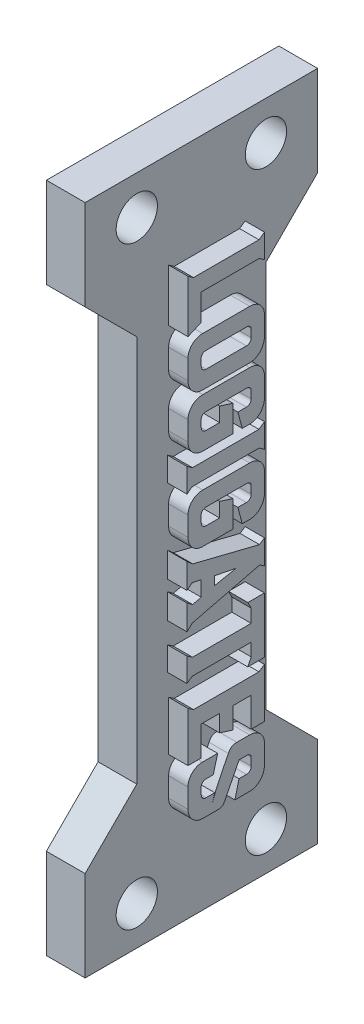
from build123d import *

# Parameters (mm, degrees)
SKETCH1_W           = 52.000002935
SKETCH1_H           = 18.000001088
SKETCH1_R           = 1.599502817
BOSS_EXTRUDE1_DEPTH = 2.999998629
SKETCH2_W           = 4
SKETCH2_H           = 30
CUT_EXTRUDE1_DEPTH  = 84.68851942
BOSS_EXTRUDE2_DEPTH = 1.5


# Read off the part's stored shape, not the designer's step: Boss-Extrude2
with BuildPart() as part:
    # Sketch1 → Boss-Extrude1 (new body)
    with BuildSketch(Plane(origin=(120.988696814, 0, 0), x_dir=(0, -1, 0), z_dir=(-1, 0, 0))):
        with Locations((49.005120062, 27.999999933)):
            Rectangle(SKETCH1_W, SKETCH1_H)
        with Locations(Location((26.005118371, 32.999999236, 0), (0, 0, 90))):
            Circle(SKETCH1_R, mode=Mode.SUBTRACT)
        with Locations(Location((26.005118371, 23.000000115, 0), (0, 0, 90))):
            Circle(SKETCH1_R, mode=Mode.SUBTRACT)
        with Locations(Location((72.005118202, 32.999999236, 0), (0, 0, 90))):
            Circle(SKETCH1_R, mode=Mode.SUBTRACT)
        with Locations(Location((72.005118202, 23.000000115, 0), (0, 0, 90))):
            Circle(SKETCH1_R, mode=Mode.SUBTRACT)
    extrude(amount=-BOSS_EXTRUDE1_DEPTH)

    # Sketch2 → Cut-Extrude1 (cut, through all)
    with BuildSketch(Plane.ZY.offset(-120.988696814)):
        with Locations((35.000000477, -49.005120061)):
            Rectangle(SKETCH2_W, SKETCH2_H)
        Polygon((33.000000477, -34.005120061), (37.000000477, -34.005120061), (37.000000477, -30.005120061), align=None)
        Polygon((22.999999389, -34.005120061), (18.999999389, -30.005120061), (18.999999389, -34.005120061), align=None)
        with Locations((20.999999389, -49.005120061)):
            Rectangle(SKETCH2_W, SKETCH2_H)
        Polygon((22.999999389, -64.005120061), (18.999999389, -64.005120061), (18.999999389, -68.005120061), align=None)
        Polygon((37.000000477, -68.005120061), (37.000000477, -64.005120061), (33.000000477, -64.005120061), align=None)
    extrude(amount=-CUT_EXTRUDE1_DEPTH, mode=Mode.SUBTRACT)

    # Boss-Extrude2 outline → Boss-Extrude2 (add)
    # profile 1 of 9: a face of its own
    with BuildSketch(Plane(origin=(123.988695443, 0, 0), x_dir=(0, 0, -1), z_dir=(1, 0, 0))):
        with BuildLine():
            add(Edge.make_bspline(
                [(-25.753945133, -34.83406743), (-25.715646692, -34.834896821), (-25.639935186, -34.836536429), (-25.52792408, -34.853255531), (-25.419341153, -34.880353785), (-25.314353768, -34.917863147), (-25.213548377, -34.962661631), (-25.119050654, -35.017514815), (-25.031442741, -35.080760556), (-24.949756401, -35.15098251), (-24.87544198, -35.228788716), (-24.809613425, -35.314359758), (-24.753268897, -35.40752816), (-24.703586132, -35.505728989), (-24.664134007, -35.609427085), (-24.635438933, -35.716823207), (-24.619535321, -35.827427877), (-24.616768551, -35.901866236), (-24.615376054, -35.939330588)],
                knots=[0, 0, 0, 0, 0.065110472, 0.128715735, 0.192163116, 0.255212122, 0.318136847, 0.37956254, 0.440708825, 0.501706905, 0.56256044, 0.623417995, 0.684959072, 0.747521206, 0.810395372, 0.873339532, 0.936252593, 1, 1, 1, 1], degree=3))
            Line((-25.753945133, -34.83406743), (-29.397859606, -34.83406743))
            add(Edge.make_bspline(
                [(-30.536428685, -35.939330588), (-30.535030069, -35.901048939), (-30.532265879, -35.825390035), (-30.516737224, -35.713861391), (-30.487417341, -35.607163639), (-30.449364622, -35.504622703), (-30.401506552, -35.406709273), (-30.342631198, -35.316273818), (-30.279154698, -35.229462956), (-30.203990491, -35.152350295), (-30.123264988, -35.080708007), (-30.034990576, -35.017146346), (-29.939956723, -34.963375023), (-29.839365929, -34.917212488), (-29.733989538, -34.88067626), (-29.624747681, -34.853050295), (-29.512261062, -34.836634872), (-29.436152778, -34.83492682), (-29.397859606, -34.83406743)],
                knots=[0, 0, 0, 0, 0.065098132, 0.128658341, 0.190882416, 0.252811356, 0.3143922, 0.375666838, 0.436058047, 0.496868476, 0.558282488, 0.61938546, 0.68137354, 0.743617241, 0.807281134, 0.870683572, 0.934935649, 1, 1, 1, 1], degree=3))
            Line((-30.536428685, -35.939330588), (-30.536428685, -37.439330588))
            add(Edge.make_bspline(
                [(-29.397859606, -38.623541114), (-29.433706502, -38.622752572), (-29.504946081, -38.621185481), (-29.610019175, -38.603696784), (-29.71362287, -38.579721977), (-29.814257749, -38.543533718), (-29.91265578, -38.49812116), (-30.005372406, -38.440670506), (-30.095818992, -38.376733), (-30.178945651, -38.301040503), (-30.256751675, -38.217745647), (-30.326279633, -38.125372122), (-30.387984766, -38.025518081), (-30.440749541, -37.918137496), (-30.484909639, -37.80508417), (-30.51320015, -37.686258576), (-30.533189742, -37.564179072), (-30.535338429, -37.481355682), (-30.536428685, -37.439330588)],
                knots=[0, 0, 0, 0, 0.058923256, 0.117099901, 0.174861994, 0.233707515, 0.292727797, 0.352831673, 0.412920316, 0.474725104, 0.537441537, 0.600227269, 0.664628921, 0.730287018, 0.796883061, 0.863832147, 0.9309076, 1, 1, 1, 1], degree=3))
            Line((-29.397859606, -38.623541114), (-25.753945133, -38.623541114))
            add(Edge.make_bspline(
                [(-24.615376054, -37.439330588), (-24.616570493, -37.480920674), (-24.618935957, -37.563285538), (-24.637586024, -37.685097207), (-24.670582476, -37.802886299), (-24.713305054, -37.91691552), (-24.765972549, -38.025292708), (-24.828385201, -38.125498925), (-24.897181481, -38.218778816), (-24.97483879, -38.302465737), (-25.059243997, -38.375994441), (-25.146942281, -38.44273184), (-25.240878734, -38.497739799), (-25.338699724, -38.543658655), (-25.439436551, -38.579689276), (-25.543013641, -38.603705396), (-25.647686877, -38.621116137), (-25.718511364, -38.622732461), (-25.753945133, -38.623541114)],
                knots=[0, 0, 0, 0, 0.068473129, 0.135603948, 0.202296223, 0.269580539, 0.335900537, 0.400355349, 0.463734165, 0.526502366, 0.587908087, 0.647901298, 0.707706976, 0.766775975, 0.825670069, 0.883479841, 0.941704506, 1, 1, 1, 1], degree=3))
            Line((-24.615376054, -37.439330588), (-24.615376054, -35.939330588))
        make_face()
        with BuildLine():
            add(Edge.make_bspline(
                [(-25.641691843, -36.376008219), (-25.643088446, -36.360669844), (-25.645999876, -36.328694665), (-25.664027303, -36.281145665), (-25.695509509, -36.234848621), (-25.736191743, -36.188614344), (-25.789396823, -36.147280313), (-25.854788892, -36.117739509), (-25.931107707, -36.100428033), (-25.985343902, -36.098338176), (-26.014224738, -36.097225324)],
                knots=[0, 0, 0, 0, 0.089709726, 0.187013585, 0.292979927, 0.415496493, 0.545733389, 0.683341826, 0.831379156, 1, 1, 1, 1], degree=3))
            Line((-25.641691843, -36.376008219), (-25.641691843, -36.992784535))
            add(Edge.make_bspline(
                [(-26.014224738, -37.360383219), (-25.988959897, -37.359484958), (-25.939141658, -37.357713731), (-25.868833327, -37.335193728), (-25.803298366, -37.303175078), (-25.747500931, -37.255740727), (-25.700752592, -37.199898654), (-25.666547765, -37.136151309), (-25.644466847, -37.066602488), (-25.642625552, -37.017622152), (-25.641691843, -36.992784535)],
                knots=[0, 0, 0, 0, 0.129446376, 0.255247618, 0.376319761, 0.502511525, 0.628703289, 0.748885457, 0.872661416, 1, 1, 1, 1], degree=3))
            Line((-26.014224738, -37.360383219), (-29.128945133, -37.360383219))
            add(Edge.make_bspline(
                [(-29.510112896, -36.992784535), (-29.508500951, -37.017559082), (-29.505332087, -37.066262471), (-29.485923624, -37.136730715), (-29.449467185, -37.19984223), (-29.401798555, -37.256268155), (-29.343610533, -37.30285699), (-29.276814748, -37.335258399), (-29.205224107, -37.357698944), (-29.154613727, -37.359479935), (-29.128945133, -37.360383219)],
                knots=[0, 0, 0, 0, 0.126108466, 0.247912095, 0.367760947, 0.493886754, 0.621922754, 0.743510737, 0.869913667, 1, 1, 1, 1], degree=3))
            Line((-29.510112896, -36.992784535), (-29.510112896, -36.376008219))
            add(Edge.make_bspline(
                [(-29.128945133, -36.097225324), (-29.158252794, -36.098310234), (-29.213331105, -36.10034912), (-29.291006732, -36.118122228), (-29.35888972, -36.146679383), (-29.412540398, -36.190017244), (-29.455318104, -36.235564369), (-29.485786696, -36.282452829), (-29.506312409, -36.328737474), (-29.508874683, -36.360607234), (-29.510112896, -36.376008219)],
                knots=[0, 0, 0, 0, 0.168868632, 0.317357255, 0.457559029, 0.589486773, 0.712058606, 0.816693417, 0.911417531, 1, 1, 1, 1], degree=3))
            Line((-29.128945133, -36.097225324), (-26.014224738, -36.097225324))
        make_face(mode=Mode.SUBTRACT)
    # profile 2 of 9: a face of its own
    with BuildSketch(Plane(origin=(123.988695443, 0, 0), x_dir=(0, 0, -1), z_dir=(1, 0, 0))):
        with BuildLine():
            add(Edge.make_bspline(
                [(-25.761346449, -38.939330588), (-25.721817508, -38.940153529), (-25.644063511, -38.941772266), (-25.529545103, -38.958342312), (-25.419409631, -38.985732775), (-25.313660575, -39.022474388), (-25.213143231, -39.068714665), (-25.118106072, -39.121944354), (-25.031372676, -39.186509589), (-24.94970738, -39.256173732), (-24.875455098, -39.334071123), (-24.809609868, -39.419617697), (-24.753269872, -39.512792749), (-24.703585867, -39.610991759), (-24.664134079, -39.714690347), (-24.635438914, -39.822086337), (-24.619535325, -39.932691042), (-24.616768553, -40.007129396), (-24.615376054, -40.044593746)],
                knots=[0, 0, 0, 0, 0.066924376, 0.131641216, 0.195497742, 0.258938856, 0.320964749, 0.382735915, 0.443060732, 0.503802306, 0.564399942, 0.625001581, 0.686283868, 0.748582918, 0.811192689, 0.873872159, 0.936520661, 1, 1, 1, 1], degree=3))
            Line((-25.761346449, -38.939330588), (-29.390458291, -38.939330588))
            add(Edge.make_bspline(
                [(-30.536428685, -40.044593746), (-30.535030069, -40.006312097), (-30.532265879, -39.930653193), (-30.516737224, -39.819124548), (-30.487417341, -39.712426797), (-30.449364621, -39.609885861), (-30.401506552, -39.511972429), (-30.342631196, -39.421536982), (-30.279154705, -39.33472609), (-30.203990465, -39.257613543), (-30.123265084, -39.185970826), (-30.034990216, -39.122410768), (-29.939958089, -39.068633378), (-29.839360759, -39.022493816), (-29.733631796, -38.985738785), (-29.623102311, -38.958199463), (-29.508139227, -38.941854471), (-29.429984074, -38.94017829), (-29.390458291, -38.939330588)],
                knots=[0, 0, 0, 0, 0.064828604, 0.128125652, 0.190092099, 0.251764632, 0.313090511, 0.374111451, 0.434252621, 0.494811274, 0.555971012, 0.616820997, 0.678552425, 0.740538417, 0.803938719, 0.867754167, 0.933118677, 1, 1, 1, 1], degree=3))
            Line((-30.536428685, -40.044593746), (-30.536428685, -41.544593746))
            add(Edge.make_bspline(
                [(-29.392925396, -42.728804272), (-29.429997101, -42.727999641), (-29.503266916, -42.726409342), (-29.611427546, -42.709350742), (-29.716730939, -42.683524549), (-29.818922166, -42.647961746), (-29.916986038, -42.602219096), (-30.009153077, -42.546068557), (-30.097804067, -42.483117279), (-30.180294275, -42.410557244), (-30.255603921, -42.328181173), (-30.325771391, -42.238377852), (-30.384889712, -42.137375945), (-30.440328473, -42.030958334), (-30.483109797, -41.916201529), (-30.513803006, -41.796287904), (-30.533043448, -41.671857489), (-30.535289325, -41.587426562), (-30.536428685, -41.544593746)],
                knots=[0, 0, 0, 0, 0.060717425, 0.120004044, 0.179014195, 0.238270159, 0.297064382, 0.35601292, 0.414930627, 0.475099446, 0.535670811, 0.597679965, 0.661483507, 0.727191528, 0.794162852, 0.861674603, 0.929825877, 1, 1, 1, 1], degree=3))
            Line((-29.392925396, -42.728804272), (-27.062744475, -42.728804272))
            Line((-27.062744475, -42.728804272), (-27.062744475, -40.679873351))
            Line((-27.062744475, -40.679873351), (-28.089060264, -40.354215456))
            Line((-28.089060264, -40.354215456), (-28.089060264, -41.465646377))
            Line((-28.089060264, -41.465646377), (-29.125244475, -41.465646377))
            add(Edge.make_bspline(
                [(-29.510112896, -41.101748351), (-29.508504996, -41.126525799), (-29.505344084, -41.175234893), (-29.485877849, -41.245661694), (-29.449796141, -41.308656632), (-29.401716386, -41.364091931), (-29.342992207, -41.409539974), (-29.276094212, -41.441855107), (-29.20298233, -41.462835619), (-29.151710726, -41.46468944), (-29.125244475, -41.465646377)],
                knots=[0, 0, 0, 0, 0.125781918, 0.247270146, 0.366808659, 0.491024116, 0.617444393, 0.740586809, 0.866091673, 1, 1, 1, 1], degree=3))
            Line((-29.510112896, -41.101748351), (-29.510112896, -40.48743914))
            add(Edge.make_bspline(
                [(-29.128945133, -40.202488482), (-29.158246407, -40.203581895), (-29.213312714, -40.205636762), (-29.29106861, -40.223303011), (-29.358445598, -40.252127426), (-29.412880161, -40.293987237), (-29.455643934, -40.339802604), (-29.486153056, -40.388039873), (-29.506481502, -40.436943052), (-29.508917006, -40.47080978), (-29.510112896, -40.48743914)],
                knots=[0, 0, 0, 0, 0.166860808, 0.313583922, 0.452118718, 0.58105776, 0.702172231, 0.807537489, 0.905496383, 1, 1, 1, 1], degree=3))
            Line((-29.128945133, -40.202488482), (-26.014224738, -40.202488482))
            add(Edge.make_bspline(
                [(-25.641691843, -40.48743914), (-25.642946527, -40.470426914), (-25.645459933, -40.436347705), (-25.664348728, -40.386281149), (-25.694328555, -40.338391239), (-25.735510917, -40.292359591), (-25.787611013, -40.251444173), (-25.853664257, -40.22262305), (-25.930332779, -40.20592285), (-25.98535329, -40.203670421), (-26.014224738, -40.202488482)],
                knots=[0, 0, 0, 0, 0.097876018, 0.196067073, 0.304581129, 0.422064857, 0.550508518, 0.683082698, 0.833700901, 1, 1, 1, 1], degree=3))
            Line((-25.641691843, -40.48743914), (-25.641691843, -41.101748351))
            add(Edge.make_bspline(
                [(-26.014224738, -41.465646377), (-25.988573875, -41.464693317), (-25.938905361, -41.46284788), (-25.868242473, -41.441824179), (-25.803705905, -41.409502055), (-25.747547357, -41.363607355), (-25.700436067, -41.308692944), (-25.666592919, -41.245085286), (-25.644455036, -41.175574109), (-25.642621578, -41.126588593), (-25.641691843, -41.101748351)],
                knots=[0, 0, 0, 0, 0.132013095, 0.255620808, 0.377115099, 0.502405858, 0.627408674, 0.748009886, 0.872217419, 1, 1, 1, 1], degree=3))
            Line((-26.014224738, -41.465646377), (-26.670474738, -41.465646377))
            Line((-26.670474738, -41.465646377), (-26.33371487, -42.728804272))
            Line((-26.33371487, -42.728804272), (-25.737908949, -42.728804272))
            add(Edge.make_bspline(
                [(-24.615376054, -41.544593746), (-24.616685457, -41.586991408), (-24.619277012, -41.670904401), (-24.636164995, -41.794805704), (-24.667703255, -41.91357257), (-24.709565288, -42.027108438), (-24.761181046, -42.133903281), (-24.820959837, -42.233144115), (-24.886866043, -42.325207433), (-24.962970021, -42.406389222), (-25.044415357, -42.479322346), (-25.131118511, -42.543751328), (-25.223036483, -42.599845887), (-25.320173889, -42.646413053), (-25.420887279, -42.683592209), (-25.524725822, -42.709439802), (-25.630446989, -42.726273632), (-25.702072536, -42.727960354), (-25.737908949, -42.728804272)],
                knots=[0, 0, 0, 0, 0.070161864, 0.138863598, 0.206358723, 0.273091673, 0.338821641, 0.402298032, 0.464626367, 0.525773744, 0.586005803, 0.645335734, 0.704262468, 0.763907561, 0.823315465, 0.881566652, 0.940744239, 1, 1, 1, 1], degree=3))
            Line((-24.615376054, -41.544593746), (-24.615376054, -40.044593746))
        make_face()
    # profile 3 of 9: a face of its own
    with BuildSketch(Plane(origin=(123.988695443, 0, 0), x_dir=(0, 0, -1), z_dir=(1, 0, 0))):
        with BuildLine():
            add(Edge.make_bspline(
                [(-25.761346449, -45.33406743), (-25.721817508, -45.334890371), (-25.644063511, -45.336509108), (-25.529545103, -45.353079154), (-25.419409631, -45.380469617), (-25.313660575, -45.41721123), (-25.213143231, -45.463451507), (-25.118106072, -45.516681196), (-25.031372676, -45.581246431), (-24.94970738, -45.650910574), (-24.875455098, -45.728807965), (-24.809609868, -45.814354539), (-24.753269872, -45.907529591), (-24.703585867, -46.005728601), (-24.664134079, -46.109427189), (-24.635438914, -46.216823179), (-24.619535325, -46.327427884), (-24.616768553, -46.401866238), (-24.615376054, -46.439330588)],
                knots=[0, 0, 0, 0, 0.066924376, 0.131641216, 0.195497742, 0.258938856, 0.320964749, 0.382735915, 0.443060732, 0.503802306, 0.564399942, 0.625001581, 0.686283868, 0.748582918, 0.811192689, 0.873872159, 0.936520661, 1, 1, 1, 1], degree=3))
            Line((-25.761346449, -45.33406743), (-29.390458291, -45.33406743))
            add(Edge.make_bspline(
                [(-30.536428685, -46.439330588), (-30.535030069, -46.401048939), (-30.532265879, -46.325390035), (-30.516737224, -46.213861391), (-30.487417341, -46.107163639), (-30.449364621, -46.004622703), (-30.401506552, -45.906709271), (-30.342631196, -45.816273824), (-30.279154705, -45.729462932), (-30.203990465, -45.652350385), (-30.123265084, -45.580707668), (-30.034990216, -45.51714761), (-29.939958089, -45.463370221), (-29.839360759, -45.417230658), (-29.733631796, -45.380475627), (-29.623102311, -45.352936305), (-29.508139227, -45.336591313), (-29.429984074, -45.334915133), (-29.390458291, -45.33406743)],
                knots=[0, 0, 0, 0, 0.064828604, 0.128125652, 0.190092099, 0.251764632, 0.313090511, 0.374111451, 0.434252621, 0.494811274, 0.555971012, 0.616820997, 0.678552425, 0.740538417, 0.803938719, 0.867754167, 0.933118677, 1, 1, 1, 1], degree=3))
            Line((-30.536428685, -46.439330588), (-30.536428685, -47.939330588))
            add(Edge.make_bspline(
                [(-29.392925396, -49.123541114), (-29.429997101, -49.122736484), (-29.503266916, -49.121146184), (-29.611427546, -49.104087584), (-29.716730939, -49.078261392), (-29.818922166, -49.042698588), (-29.916986038, -48.996955938), (-30.009153077, -48.9408054), (-30.097804067, -48.877854121), (-30.180294275, -48.805294086), (-30.255603921, -48.722918015), (-30.325771391, -48.633114694), (-30.384889712, -48.532112787), (-30.440328473, -48.425695176), (-30.483109797, -48.310938371), (-30.513803006, -48.191024746), (-30.533043448, -48.066594331), (-30.535289325, -47.982163404), (-30.536428685, -47.939330588)],
                knots=[0, 0, 0, 0, 0.060717425, 0.120004044, 0.179014195, 0.238270159, 0.297064382, 0.35601292, 0.414930627, 0.475099446, 0.535670811, 0.597679965, 0.661483507, 0.727191528, 0.794162852, 0.861674603, 0.929825877, 1, 1, 1, 1], degree=3))
            Line((-29.392925396, -49.123541114), (-27.062744475, -49.123541114))
            Line((-27.062744475, -49.123541114), (-27.062744475, -47.074610193))
            Line((-27.062744475, -47.074610193), (-28.089060264, -46.748952298))
            Line((-28.089060264, -46.748952298), (-28.089060264, -47.860383219))
            Line((-28.089060264, -47.860383219), (-29.125244475, -47.860383219))
            add(Edge.make_bspline(
                [(-29.510112896, -47.496485193), (-29.508504996, -47.521262641), (-29.505344084, -47.569971735), (-29.485877849, -47.640398536), (-29.449796141, -47.703393474), (-29.401716386, -47.758828773), (-29.342992207, -47.804276816), (-29.276094212, -47.836591949), (-29.20298233, -47.857572461), (-29.151710726, -47.859426282), (-29.125244475, -47.860383219)],
                knots=[0, 0, 0, 0, 0.125781918, 0.247270146, 0.366808659, 0.491024116, 0.617444393, 0.740586809, 0.866091673, 1, 1, 1, 1], degree=3))
            Line((-29.510112896, -47.496485193), (-29.510112896, -46.882175982))
            add(Edge.make_bspline(
                [(-29.128945133, -46.597225324), (-29.158246407, -46.598318737), (-29.213312714, -46.600373604), (-29.29106861, -46.618039853), (-29.358445598, -46.646864269), (-29.412880161, -46.688724079), (-29.455643934, -46.734539447), (-29.486153056, -46.782776716), (-29.506481502, -46.831679894), (-29.508917006, -46.865546623), (-29.510112896, -46.882175982)],
                knots=[0, 0, 0, 0, 0.166860808, 0.313583922, 0.452118718, 0.58105776, 0.702172231, 0.807537489, 0.905496383, 1, 1, 1, 1], degree=3))
            Line((-29.128945133, -46.597225324), (-26.014224738, -46.597225324))
            add(Edge.make_bspline(
                [(-25.641691843, -46.882175982), (-25.642946527, -46.865163756), (-25.645459933, -46.831084547), (-25.664348728, -46.781017991), (-25.694328555, -46.733128081), (-25.735510917, -46.687096433), (-25.787611013, -46.646181015), (-25.853664257, -46.617359892), (-25.930332779, -46.600659692), (-25.98535329, -46.598407263), (-26.014224738, -46.597225324)],
                knots=[0, 0, 0, 0, 0.097876018, 0.196067073, 0.304581129, 0.422064857, 0.550508518, 0.683082698, 0.833700901, 1, 1, 1, 1], degree=3))
            Line((-25.641691843, -46.882175982), (-25.641691843, -47.496485193))
            add(Edge.make_bspline(
                [(-26.014224738, -47.860383219), (-25.988573875, -47.859430159), (-25.938905361, -47.857584722), (-25.868242473, -47.836561021), (-25.803705905, -47.804238897), (-25.747547357, -47.758344197), (-25.700436067, -47.703429786), (-25.666592919, -47.639822128), (-25.644455036, -47.570310951), (-25.642621578, -47.521325436), (-25.641691843, -47.496485193)],
                knots=[0, 0, 0, 0, 0.132013095, 0.255620808, 0.377115099, 0.502405858, 0.627408674, 0.748009886, 0.872217419, 1, 1, 1, 1], degree=3))
            Line((-26.014224738, -47.860383219), (-26.670474738, -47.860383219))
            Line((-26.670474738, -47.860383219), (-26.33371487, -49.123541114))
            Line((-26.33371487, -49.123541114), (-25.737908949, -49.123541114))
            add(Edge.make_bspline(
                [(-24.615376054, -47.939330588), (-24.616685457, -47.98172825), (-24.619277012, -48.065641243), (-24.636164995, -48.189542546), (-24.667703255, -48.308309412), (-24.709565288, -48.42184528), (-24.761181046, -48.528640123), (-24.820959837, -48.627880957), (-24.886866043, -48.719944275), (-24.962970021, -48.801126065), (-25.044415357, -48.874059188), (-25.131118511, -48.938488171), (-25.223036483, -48.994582729), (-25.320173889, -49.041149896), (-25.420887279, -49.078329051), (-25.524725822, -49.104176644), (-25.630446989, -49.121010474), (-25.702072536, -49.122697196), (-25.737908949, -49.123541114)],
                knots=[0, 0, 0, 0, 0.070161864, 0.138863598, 0.206358723, 0.273091673, 0.338821641, 0.402298032, 0.464626367, 0.525773744, 0.586005803, 0.645335734, 0.704262468, 0.763907561, 0.823315465, 0.881566652, 0.940744239, 1, 1, 1, 1], degree=3))
            Line((-24.615376054, -47.939330588), (-24.615376054, -46.439330588))
        make_face()
    # profile 4 of 9: a face of its own
    with BuildSketch(Plane(origin=(123.988695443, 0, 0), x_dir=(0, 0, -1), z_dir=(1, 0, 0))):
        with BuildLine():
            add(Edge.make_bspline(
                [(-29.510112896, -65.72962664), (-29.508501925, -65.754402443), (-29.505334974, -65.803108301), (-29.485912608, -65.873558611), (-29.449508697, -65.936737883), (-29.401842391, -65.992651945), (-29.344741241, -66.040093702), (-29.278328973, -66.071771408), (-29.207348865, -66.0947188), (-29.157098891, -66.096377456), (-29.131412238, -66.097225324)],
                knots=[0, 0, 0, 0, 0.126569003, 0.248817448, 0.369103978, 0.495690385, 0.622554927, 0.744586939, 0.869438604, 1, 1, 1, 1], degree=3))
            Line((-29.510112896, -65.72962664), (-29.510112896, -65.122718746))
            add(Edge.make_bspline(
                [(-29.128945133, -64.83406743), (-29.158253625, -64.835151737), (-29.213333497, -64.837189492), (-29.290998685, -64.854970166), (-29.358917437, -64.8835014), (-29.412446377, -64.926927493), (-29.456104494, -64.972691624), (-29.486147111, -65.022175424), (-29.506340742, -65.071862486), (-29.508880066, -65.106097713), (-29.510112896, -65.122718746)],
                knots=[0, 0, 0, 0, 0.165931403, 0.311837279, 0.449600443, 0.579233493, 0.699673363, 0.80643008, 0.906022762, 1, 1, 1, 1], degree=3))
            Line((-29.128945133, -64.83406743), (-28.576313554, -64.83406743))
            Line((-28.576313554, -64.83406743), (-28.238320133, -63.570909535))
            Line((-28.238320133, -63.570909535), (-29.413895791, -63.570909535))
            add(Edge.make_bspline(
                [(-30.536428685, -64.676172693), (-30.535756432, -64.637851585), (-30.534433529, -64.562440929), (-30.515696871, -64.451882823), (-30.489130927, -64.345045946), (-30.450647331, -64.242603271), (-30.402230911, -64.145645067), (-30.347226986, -64.053599298), (-30.281811508, -63.96917726), (-30.209584323, -63.890304611), (-30.129535226, -63.819185648), (-30.043375666, -63.755431526), (-29.951228159, -63.699654469), (-29.851952387, -63.654502158), (-29.748151851, -63.617012097), (-29.639909153, -63.590121809), (-29.527907715, -63.573372317), (-29.452194895, -63.571736838), (-29.413895791, -63.570909535)],
                knots=[0, 0, 0, 0, 0.06553698, 0.128967739, 0.191465613, 0.253844406, 0.315872575, 0.376848966, 0.437118089, 0.498402608, 0.559735637, 0.620144414, 0.681723446, 0.743779578, 0.806578115, 0.870441109, 0.93446302, 1, 1, 1, 1], degree=3))
            Line((-30.536428685, -64.676172693), (-30.536428685, -66.176172693))
            add(Edge.make_bspline(
                [(-29.391691843, -67.360383219), (-29.42755042, -67.35968904), (-29.498877795, -67.358308228), (-29.604825521, -67.339226017), (-29.70997099, -67.312752837), (-29.813153479, -67.274306685), (-29.912968777, -67.226204311), (-30.007779285, -67.169433335), (-30.0972867, -67.105080364), (-30.180305352, -67.032294997), (-30.255646427, -66.949911558), (-30.325366774, -66.860254488), (-30.385288929, -66.760147915), (-30.440005111, -66.654170594), (-30.482924076, -66.540776326), (-30.513972939, -66.422575474), (-30.532886099, -66.300550181), (-30.535243942, -66.217768112), (-30.536428685, -66.176172693)],
                knots=[0, 0, 0, 0, 0.058871164, 0.117102405, 0.176452833, 0.236977272, 0.297746575, 0.358376615, 0.418412136, 0.478758901, 0.539509403, 0.601701946, 0.665116777, 0.731019126, 0.797556294, 0.863959414, 0.931643829, 1, 1, 1, 1], degree=3))
            Line((-29.391691843, -67.360383219), (-28.243254343, -67.360383219))
            add(Edge.make_bspline(
                [(-27.657316843, -66.968113482), (-27.681503408, -67.015789245), (-27.725299058, -67.102117794), (-27.802417755, -67.208915189), (-27.877774484, -67.285750008), (-27.980557293, -67.334145247), (-28.103093943, -67.352337156), (-28.197621019, -67.357763588), (-28.243254343, -67.360383219)],
                knots=[0, 0, 0, 0, 0.209852056, 0.379988119, 0.517281491, 0.627209957, 0.820034114, 1, 1, 1, 1], degree=3))
            Line((-27.657316843, -66.968113482), (-26.577958291, -64.83406743))
            Line((-26.577958291, -64.83406743), (-26.011757633, -64.83406743))
            add(Edge.make_bspline(
                [(-25.641691843, -65.122718746), (-25.642998141, -65.105723246), (-25.645644751, -65.071289708), (-25.664022386, -65.02062274), (-25.694648047, -64.971920202), (-25.736230603, -64.92596487), (-25.78823413, -64.883711011), (-25.853622937, -64.854663234), (-25.929451179, -64.837339259), (-25.983283683, -64.83519932), (-26.011757633, -64.83406743)],
                knots=[0, 0, 0, 0, 0.09788928, 0.198327449, 0.306856208, 0.427702212, 0.554291369, 0.690023461, 0.836042243, 1, 1, 1, 1], degree=3))
            Line((-25.641691843, -65.122718746), (-25.641691843, -65.72962664))
            add(Edge.make_bspline(
                [(-26.014224738, -66.097225324), (-25.988959897, -66.096327064), (-25.939141658, -66.094555836), (-25.868833327, -66.072035833), (-25.803298366, -66.040017183), (-25.747500931, -65.992582832), (-25.700752592, -65.936740759), (-25.666547765, -65.872993414), (-25.644466847, -65.803444594), (-25.642625552, -65.754464257), (-25.641691843, -65.72962664)],
                knots=[0, 0, 0, 0, 0.129446376, 0.255247618, 0.376319761, 0.502511525, 0.628703289, 0.748885457, 0.872661416, 1, 1, 1, 1], degree=3))
            Line((-26.014224738, -66.097225324), (-26.585359606, -66.097225324))
            Line((-26.585359606, -66.097225324), (-26.904849738, -67.360383219))
            Line((-26.904849738, -67.360383219), (-25.730507633, -67.360383219))
            add(Edge.make_bspline(
                [(-24.615376054, -66.176172693), (-24.616672008, -66.217340579), (-24.619236478, -66.298804754), (-24.636426333, -66.419790326), (-24.66793265, -66.536850012), (-24.709439897, -66.65013154), (-24.761734998, -66.756897166), (-24.819874902, -66.857571255), (-24.889156928, -66.947446574), (-24.962292345, -67.030685731), (-25.043745558, -67.103704098), (-25.129797412, -67.169194186), (-25.221516915, -67.226141714), (-25.317616335, -67.274265087), (-25.417463052, -67.312932719), (-25.520213135, -67.339348132), (-25.62454952, -67.358294643), (-25.695060034, -67.359684499), (-25.730507633, -67.360383219)],
                knots=[0, 0, 0, 0, 0.068563805, 0.135675994, 0.202945212, 0.270109785, 0.336264888, 0.400739998, 0.463329278, 0.524917851, 0.585030688, 0.645155225, 0.70482176, 0.764539358, 0.823930187, 0.88272985, 0.94104503, 1, 1, 1, 1], degree=3))
            Line((-24.615376054, -66.176172693), (-24.615376054, -64.676172693))
            add(Edge.make_bspline(
                [(-25.757645791, -63.570909535), (-25.719350887, -63.571764283), (-25.64323916, -63.57346311), (-25.530778001, -63.589946762), (-25.42181768, -63.617222727), (-25.31679193, -63.654649819), (-25.215794901, -63.699842184), (-25.120523509, -63.754029081), (-25.032283366, -63.817573208), (-24.951333841, -63.889058953), (-24.876675848, -63.967170984), (-24.809901008, -64.051868207), (-24.752930944, -64.144590536), (-24.703937583, -64.242302079), (-24.663860124, -64.345339234), (-24.635487162, -64.452450014), (-24.619458632, -64.563439013), (-24.616747788, -64.638294504), (-24.615376054, -64.676172693)],
                knots=[0, 0, 0, 0, 0.065004069, 0.129196616, 0.192540311, 0.255486283, 0.318308177, 0.380238824, 0.441285184, 0.502642296, 0.563396384, 0.624582379, 0.685428704, 0.747888599, 0.81000794, 0.872849237, 0.935659487, 1, 1, 1, 1], degree=3))
            Line((-25.757645791, -63.570909535), (-26.75558987, -63.570909535))
            add(Edge.make_bspline(
                [(-27.408139212, -63.992784535), (-27.384161146, -63.948117684), (-27.33946909, -63.864864374), (-27.261433297, -63.758961538), (-27.178733733, -63.680590395), (-27.064758534, -63.620025253), (-26.922559718, -63.582334211), (-26.809636892, -63.574607626), (-26.75558987, -63.570909535)],
                knots=[0, 0, 0, 0, 0.183124567, 0.341320828, 0.473938441, 0.591056728, 0.804271936, 1, 1, 1, 1], degree=3))
            add(Edge.make_bspline(
                [(-28.645392501, -66.705366772), (-28.610321307, -66.595601926), (-28.539194217, -66.372990346), (-28.409838498, -66.040990339), (-28.266843606, -65.702774509), (-28.046362193, -65.247672247), (-27.756266736, -64.678304969), (-27.524043597, -64.221019359), (-27.408139212, -63.992784535)],
                knots=[0, 0, 0, 0, 0.115762081, 0.234774435, 0.357872826, 0.484652193, 0.742785879, 1, 1, 1, 1], degree=3))
            Line((-28.645392501, -66.705366772), (-28.462826712, -66.097225324))
            Line((-28.462826712, -66.097225324), (-29.131412238, -66.097225324))
        make_face()
    # profile 5 of 9: a face of its own
    with BuildSketch(Plane(origin=(123.988695443, 0, 0), x_dir=(0, 0, -1), z_dir=(1, 0, 0))):
        Polygon((-30.536428685, -34.481271377), (-29.510112896, -34.028557561), (-29.510112896, -31.991962167), (-25.019981317, -31.991962167), (-24.615376054, -32.283080588), (-24.615376054, -30.42781743), (-25.042185264, -30.728804272), (-30.110853028, -30.728804272), (-30.536428685, -30.42781743), align=None)
    # profile 6 of 9: a face of its own
    with BuildSketch(Plane(origin=(123.988695443, 0, 0), x_dir=(0, 0, -1), z_dir=(1, 0, 0))):
        Polygon((-30.536428685, -63.247718746), (-29.510112896, -63.247718746), (-29.510112896, -60.965646377), (-28.089060264, -60.965646377), (-28.089060264, -62.270745061), (-27.062744475, -62.600103614), (-27.062744475, -60.965646377), (-25.641691843, -60.965646377), (-25.641691843, -63.247718746), (-24.615376054, -63.247718746), (-24.615376054, -59.411370061), (-25.040951712, -59.702488482), (-30.105918817, -59.702488482), (-30.536428685, -59.411370061), align=None)
    # profile 7 of 9: a face of its own
    with BuildSketch(Plane(origin=(123.988695443, 0, 0), x_dir=(0, 0, -1), z_dir=(1, 0, 0))):
        Polygon((-25.018747764, -44.702488482), (-24.615376054, -45.002241772), (-24.615376054, -43.138343746), (-25.04465237, -43.439330588), (-30.187333291, -43.439330588), (-30.615376054, -43.138343746), (-30.615376054, -45.002241772), (-30.212004343, -44.702488482), align=None)
    # profile 8 of 9: a face of its own
    with BuildSketch(Plane(origin=(123.988695443, 0, 0), x_dir=(0, 0, -1), z_dir=(1, 0, 0))):
        Polygon((-24.984208291, -52.563919403), (-24.615376054, -52.818031246), (-24.615376054, -50.926995061), (-25.001478028, -51.190975324), (-30.167596449, -49.901912824), (-30.615376054, -49.518277956), (-30.615376054, -51.454955588), (-30.195968159, -51.136699009), (-29.510112896, -51.295827298), (-29.510112896, -52.46633867), (-30.179931975, -52.618195719), (-30.615376054, -52.298705588), (-30.615376054, -54.236616772), (-30.194734606, -53.848047693), align=None)
        Polygon((-26.808632633, -51.870662824), (-28.483797106, -52.204955588), (-28.483797106, -51.540070719), align=None, mode=Mode.SUBTRACT)
    # profile 9 of 9: a face of its own
    with BuildSketch(Plane(origin=(123.988695443, 0, 0), x_dir=(0, 0, -1), z_dir=(1, 0, 0))):
        Polygon((-25.900737896, -58.943853614), (-24.615376054, -58.943853614), (-24.615376054, -54.625185851), (-25.900737896, -54.625185851), (-25.641691843, -55.13094243), (-25.641691843, -56.149856903), (-30.184866185, -56.149856903), (-30.615376054, -55.858738482), (-30.615376054, -57.704133219), (-30.209537238, -57.413014798), (-25.641691843, -57.413014798), (-25.641691843, -58.402324009), align=None)
    extrude(amount=BOSS_EXTRUDE2_DEPTH)


solid = part.part
